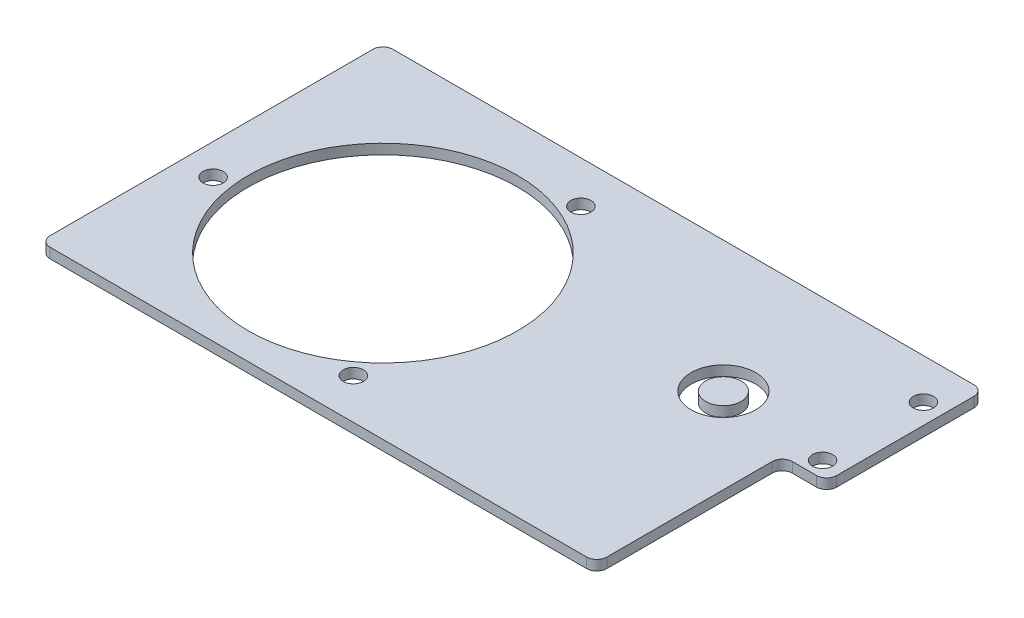
from build123d import *

# Parameters (mm, degrees)
SKETCH1_R           = 84.7725
SKETCH1_R_2         = 6.35
BOSS_EXTRUDE1_DEPTH = 6.35
SKETCH4_R           = 20.32
SKETCH4_R_2         = 11.176
CUT_EXTRUDE1_DEPTH  = 9.652


with BuildPart() as part:
    # Sketch1 → Boss-Extrude1 (new body)
    with BuildSketch(Plane(origin=(0, 0, 0), x_dir=(1, 0, 0), z_dir=(0, 1, 0))):
        with BuildLine():
            Line((257.81, 114.3), (-107.95, 114.3))
            ThreePointArc((-107.95, 114.3), (-112.440128061, 112.440128061), (-114.3, 107.95))
            Line((-114.3, 107.95), (-114.3, -95.25))
            ThreePointArc((-114.3, -95.25), (-112.440128061, -99.740128061), (-107.95, -101.6))
            Line((-107.95, -101.6), (229.87, -101.6))
            ThreePointArc((229.87, -101.6), (234.360128061, -99.740128061), (236.22, -95.25))
            Line((236.22, -95.25), (236.22, 8.89))
            ThreePointArc((236.22, 8.89), (238.079871939, 13.380128061), (242.57, 15.24))
            Line((242.57, 15.24), (257.81, 15.24))
            ThreePointArc((257.81, 15.24), (262.300128061, 17.099871939), (264.16, 21.59))
            Line((264.16, 21.59), (264.16, 107.95))
            ThreePointArc((264.16, 107.95), (262.300128061, 112.440128061), (257.81, 114.3))
        make_face()
        Circle(SKETCH1_R, mode=Mode.SUBTRACT)
        with Locations((-94.868167084, -12.066247057)):
            Circle(SKETCH1_R_2, mode=Mode.SUBTRACT)
        with Locations((36.791640664, 87.857485038)):
            Circle(SKETCH1_R_2, mode=Mode.SUBTRACT)
        with Locations((57.498227226, -76.125119177)):
            Circle(SKETCH1_R_2, mode=Mode.SUBTRACT)
        with Locations((251.46, 88.9)):
            Circle(SKETCH1_R_2, mode=Mode.SUBTRACT)
        with Locations((251.46, 25.4)):
            Circle(SKETCH1_R_2, mode=Mode.SUBTRACT)
    extrude(amount=BOSS_EXTRUDE1_DEPTH)

    # Sketch4 → Cut-Extrude1 (cut)
    with BuildSketch(Plane(origin=(0, 6.35, 0), x_dir=(1, 0, 0), z_dir=(0, 1, 0))):
        with Locations((182.500147886, 31.903476996)):
            Circle(SKETCH4_R)
        with Locations((182.500147886, 31.903476996)):
            Circle(SKETCH4_R_2, mode=Mode.SUBTRACT)
    extrude(amount=-CUT_EXTRUDE1_DEPTH, mode=Mode.SUBTRACT)


with BuildPart() as cut_extrude1_piece_1:
    # of the separate pieces the step leaves, piece 1, a body of its own (cut_extrude1_pieces)
    add(part.part.solids().sort_by_distance((257.81, 0, -114.3))[0])


with BuildPart() as cut_extrude1_piece_2:
    # of the separate pieces the step leaves, piece 2, a body of its own (cut_extrude1_pieces)
    add(part.part.solids().sort_by_distance((193.676147886, 0, -31.903476996))[0])


solid = Compound([cut_extrude1_piece_1.part, cut_extrude1_piece_2.part])
